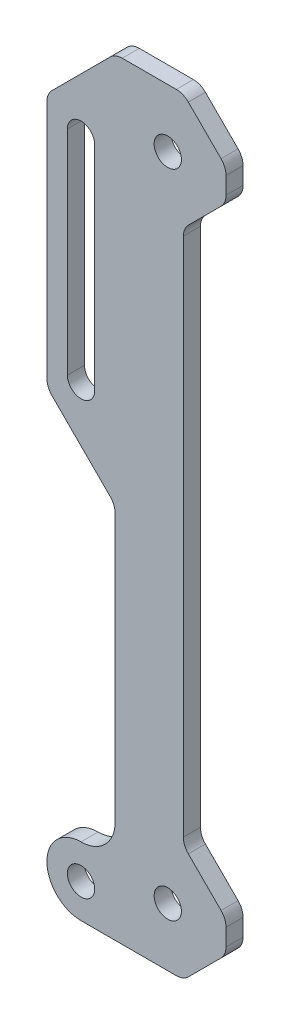
from build123d import *

# Parameters (mm, degrees)
SKETCH1_R           = 1.6
BOSS_EXTRUDE1_DEPTH = 2
FILLET1_R           = 4
FILLET2_R           = 2


with BuildPart() as part:
    # Sketch1 → Boss-Extrude1 (new body)
    with BuildSketch(Plane.XY):
        Polygon((28, -126.339745962), (28, -63.660254038), (33, -58.660254038), (33, -55), (28, -50), (20, -50), (12, -58), (12, -87.8), (20, -95.8), (20, -132), (12, -132), (12, -140), (28, -140), (33, -135), (33, -131.339745962), align=None)
        with Locations((26.169872981, -133.169872981)):
            Circle(SKETCH1_R, mode=Mode.SUBTRACT)
        with Locations((26.169872981, -56.830127019)):
            Circle(SKETCH1_R, mode=Mode.SUBTRACT)
        with Locations((16, -136)):
            Circle(SKETCH1_R, mode=Mode.SUBTRACT)
        with BuildLine():
            Line((17.6, -85.4), (17.6, -60.4))
            ThreePointArc((17.6, -60.4), (16, -58.8), (14.4, -60.4))
            Line((14.4, -60.4), (14.4, -85.4))
            ThreePointArc((14.4, -85.4), (16, -87), (17.6, -85.4))
        make_face(mode=Mode.SUBTRACT)
    extrude(amount=BOSS_EXTRUDE1_DEPTH)

    # Fillet1
    fillet1_edges = [part.edges().sort_by_distance(p)[0] for p in [
        (12, -140, 1),
        (20, -132, 1),
        (12, -132, 1),
    ]]
    fillet(fillet1_edges, radius=FILLET1_R - 0.0001)  # a hair under: the kernel refuses the full size

    # Fillet2
    fillet2_edges = [part.edges().sort_by_distance(p)[0] for p in [
        (33, -131.339745962, 1),
        (33, -135, 1),
        (28, -140, 1),
        (20, -95.8, 1),
        (12, -87.8, 1),
        (12, -58, 1),
        (20, -50, 1),
        (28, -50, 1),
        (33, -55, 1),
        (33, -58.660254038, 1),
        (28, -63.660254038, 1),
        (28, -126.339745962, 1),
    ]]
    fillet(fillet2_edges, radius=FILLET2_R)


solid = part.part
